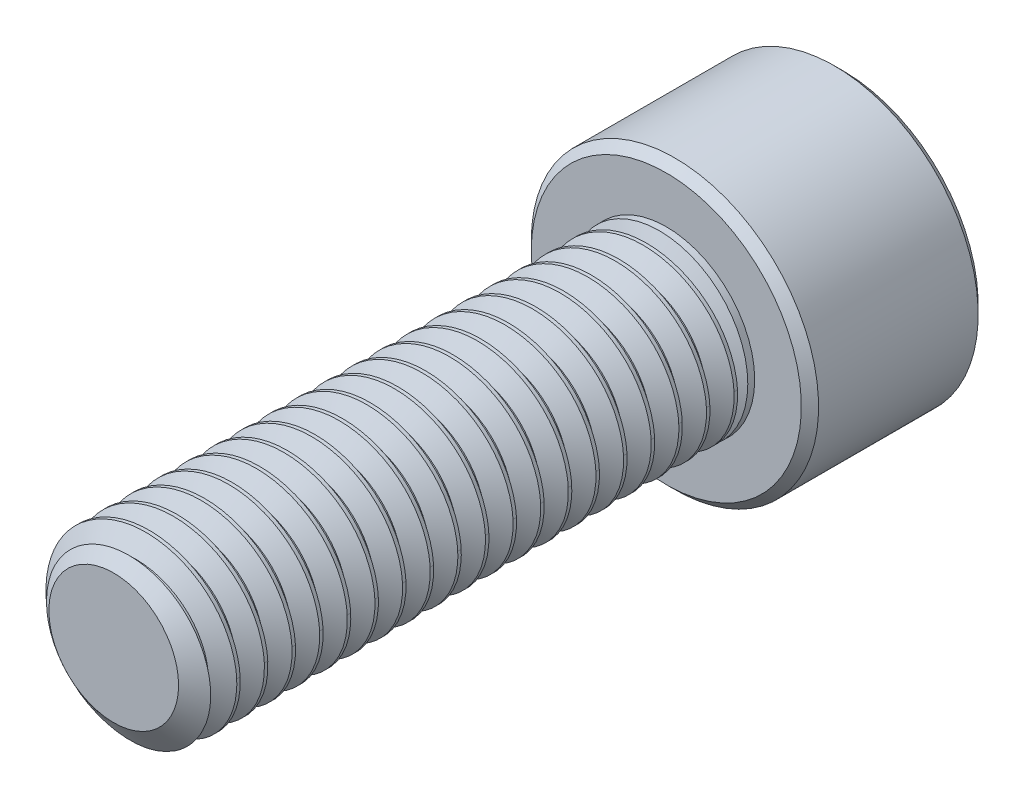
from build123d import *

# Parameters (mm, degrees)
SKETCH1_R          = 4
EXTRUDE1_DEPTH     = 25
CUT_SWEEP1_PITCH   = 1.25
SKETCH6_R          = 6.5
EXTRUDE2_DEPTH     = 8
CUT_EXTRUDE1_DEPTH = 4.5
CHAMFER1_SIZE      = 0.39


with BuildPart() as part:
    # Sketch1 → Extrude1 (new body)
    with BuildSketch(Plane.XY):
        Circle(SKETCH1_R)
    extrude(amount=-EXTRUDE1_DEPTH)

    # Cut-Sweep1: the profile of Sketch3 profile screwed along a right-hand helix of 21 turns, 6 arcs to a turn; built about Z, then put on its axis
    cut_sweep1_z = Axis((0, 0, 0), (0, 0, 1))
    cut_sweep1_corners = [(4.0003, 0, -1.093923205), (3.188101184, 0, -0.625), (3.188101184, 0, -0.46875), (4.0003, 0, 0.000173205)]
    with BuildLine(mode=Mode.PRIVATE) as cut_sweep1_profile:
        Line(cut_sweep1_corners[0], cut_sweep1_corners[1])
        Line(cut_sweep1_corners[1], cut_sweep1_corners[2])
        Line(cut_sweep1_corners[2], cut_sweep1_corners[3])
        Line(cut_sweep1_corners[3], cut_sweep1_corners[0])
    cut_sweep1_cap = Face(cut_sweep1_profile.wire())
    cut_sweep1_turn_angles = [0, 30, 60, 90, 120, 150, 180, 210, 240, 270, 300, 330, 360]
    cut_sweep1_turn_weights = [1, 0.8660254037844387, 1, 0.8660254037844387, 1, 0.8660254037844387, 1, 0.8660254037844387, 1, 0.8660254037844387, 1, 0.8660254037844387, 1]
    cut_sweep1_turn_rails = [Edge.make_bspline([Vector(p[0], p[1], 0).rotate(cut_sweep1_z, cut_sweep1_turn_angles[k]) / cut_sweep1_turn_weights[k] + Vector(0, 0, p[2] + CUT_SWEEP1_PITCH * cut_sweep1_turn_angles[k] / 360) for k in range(13)], [0, 0, 0, 1, 1, 2, 2, 3, 3, 4, 4, 5, 5, 6, 6, 6], 2, cut_sweep1_turn_weights) for p in cut_sweep1_corners]
    cut_sweep1_turn_sides = [Face.make_surface_from_curves(cut_sweep1_turn_rails[p[0]], cut_sweep1_turn_rails[p[1]]) for p in [(0, 1), (1, 2), (2, 3), (3, 0)]]
    cut_sweep1 = Plane(origin=(0, 0, 0), x_dir=(0, 1, 0), z_dir=(0, 0, -1)) * Solid(Shell([*[p.moved(Location((0, 0, CUT_SWEEP1_PITCH * i))) for i in range(21) for p in cut_sweep1_turn_sides], cut_sweep1_cap, cut_sweep1_cap.rotate(cut_sweep1_z, 7560).moved(Location((0, 0, CUT_SWEEP1_PITCH * 7560 / 360)))]))
    add(cut_sweep1, mode=Mode.SUBTRACT)

    # Sketch4 → Cut-Revolve1 (revolve, cut)
    with BuildSketch(Plane(origin=(0, 0, 0), x_dir=(0, 0, -1), z_dir=(1, 0, 0)), mode=Mode.PRIVATE) as cut_revolve1_sk:
        Polygon((0.746350386, 4), (0, 2.934101184), (0, 4), align=None)
    revolve(cut_revolve1_sk.sketch.rotate(Axis((0, 0, 0), (0, 0, -1)), 90), axis=Axis((0, 0, 0), (0, 0, -1)), mode=Mode.SUBTRACT)

    # Sketch6 → Extrude2 (add)
    with BuildSketch(Plane(origin=(0, 0, -25), x_dir=(-1, 0, 0), z_dir=(0, 0, -1))):
        Circle(SKETCH6_R)
    extrude(amount=EXTRUDE2_DEPTH)

    # Sketch7 → Cut-Extrude1 (cut)
    with BuildSketch(Plane(origin=(0, 0, -33), x_dir=(-1, 0, 0), z_dir=(0, 0, -1))):
        Polygon((0, 3.464101615), (-3, 1.732050808), (-3, -1.732050808), (0, -3.464101615), (3, -1.732050808), (3, 1.732050808), align=None)
    extrude(amount=-CUT_EXTRUDE1_DEPTH, mode=Mode.SUBTRACT)

    # Cut-Extrude2 cone 1 section (through the dimple's axis) → Cut-Extrude2 (revolve, cut)
    with BuildSketch(Plane(origin=(0, 0, -33), x_dir=(0, 1, 0), z_dir=(1, 0, 0))):
        Polygon((0, 0), (3.464101615, 0), (0, 3.464101615), align=None)
    revolve(axis=Axis((0, 0, -33), (0, 0, 1)), mode=Mode.SUBTRACT)

    # Chamfer1
    chamfer1_edges = [part.edges().sort_by_distance(p)[0] for p in [
        (6.5, 0, -25),
        (6.5, 0, -33),
    ]]
    chamfer(chamfer1_edges, length=CHAMFER1_SIZE)

    # Sketch10 → Revolve1 (revolve)
    with BuildSketch(Plane(origin=(0, 0, 0), x_dir=(0, 0, -1), z_dir=(1, 0, 0)), mode=Mode.PRIVATE) as revolve1_sk:
        Polygon((25, 4), (25, 0), (23.030645751, 0), (24.6875, 4), align=None)
    revolve(revolve1_sk.sketch.rotate(Axis((0, 0, -25), (0, 0, 1)), 270), axis=Axis((0, 0, -25), (0, 0, 1)))


solid = part.part
